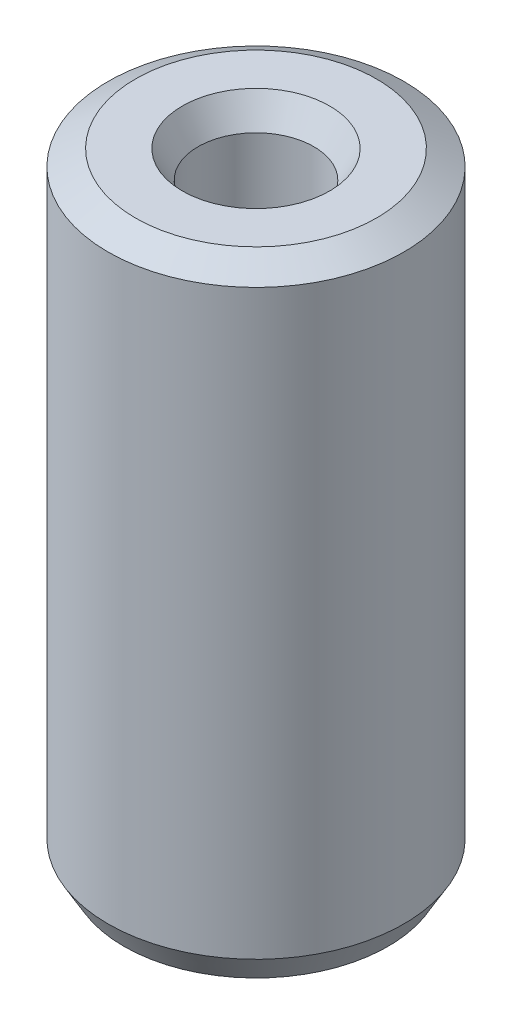
from build123d import *
from OCP.BRepFilletAPI import BRepFilletAPI_MakeChamfer

# Parameters (mm, degrees)
SKETCH1_R           = 35
BOSS_EXTRUDE1_DEPTH = 147.942980351
SKETCH2_R           = 13.702124043
CUT_EXTRUDE1_DEPTH  = 157.003607123
CHAMFER1_SIZE       = 3.736963929
CHAMFER1_SIZE2      = 6.472611392


with BuildPart() as part:
    # Sketch1 → Boss-Extrude1 (new body)
    with BuildSketch(Plane(origin=(0, 0, 0), x_dir=(1, 0, 0), z_dir=(0, 1, 0))):
        Circle(SKETCH1_R)
    extrude(amount=BOSS_EXTRUDE1_DEPTH)

    # Sketch2 → Cut-Extrude1 (cut, through all)
    with BuildSketch(Plane(origin=(0, 0, 0), x_dir=(1, 0, 0), z_dir=(0, 1, 0))):
        Circle(SKETCH2_R)
    extrude(amount=CUT_EXTRUDE1_DEPTH, mode=Mode.SUBTRACT)

    # Chamfer1: one chamfer whose edges measure the first distance from different faces: ONE call of the kernel's chamfer builder (chamfer() names one face for all edges)
    chamfer1_edges_1 = [part.edges().sort_by_distance(p)[0] for p in [
        (-13.702124043, 147.942980351, 0),
    ]]
    chamfer1_side_1 = [part.faces().sort_by_distance(p)[0] for p in [
        (-34.010050506, 147.942980351, 0),
    ]]
    chamfer1_edges_2 = [part.edges().sort_by_distance(p)[0] for p in [
        (-13.702124043, 0, 0),
    ]]
    chamfer1_side_2 = [part.faces().sort_by_distance(p)[0] for p in [
        (-13.702124043, 73.971490176, 0),
    ]]
    chamfer1_edges_3 = [part.edges().sort_by_distance(p)[0] for p in [
        (-35, 0, 0),
    ]]
    chamfer1_side_3 = [part.faces().sort_by_distance(p)[0] for p in [
        (-34.010050506, 0, 0),
    ]]
    chamfer1_edges_4 = [part.edges().sort_by_distance(p)[0] for p in [
        (-35, 147.942980351, 0),
    ]]
    chamfer1_side_4 = [part.faces().sort_by_distance(p)[0] for p in [
        (-35, 73.971490176, 0),
    ]]
    chamfer1 = BRepFilletAPI_MakeChamfer(part.part.solid().wrapped)
    for e in chamfer1_edges_1:
        chamfer1.Add(CHAMFER1_SIZE, CHAMFER1_SIZE2, e.wrapped, chamfer1_side_1[0].wrapped)  # the first distance lies on this face
    for e in chamfer1_edges_2:
        chamfer1.Add(CHAMFER1_SIZE, CHAMFER1_SIZE2, e.wrapped, chamfer1_side_2[0].wrapped)  # the first distance lies on this face
    for e in chamfer1_edges_3:
        chamfer1.Add(CHAMFER1_SIZE, CHAMFER1_SIZE2, e.wrapped, chamfer1_side_3[0].wrapped)  # the first distance lies on this face
    for e in chamfer1_edges_4:
        chamfer1.Add(CHAMFER1_SIZE, CHAMFER1_SIZE2, e.wrapped, chamfer1_side_4[0].wrapped)  # the first distance lies on this face
    add(Compound.cast(chamfer1.Shape()), mode=Mode.REPLACE)


solid = part.part
